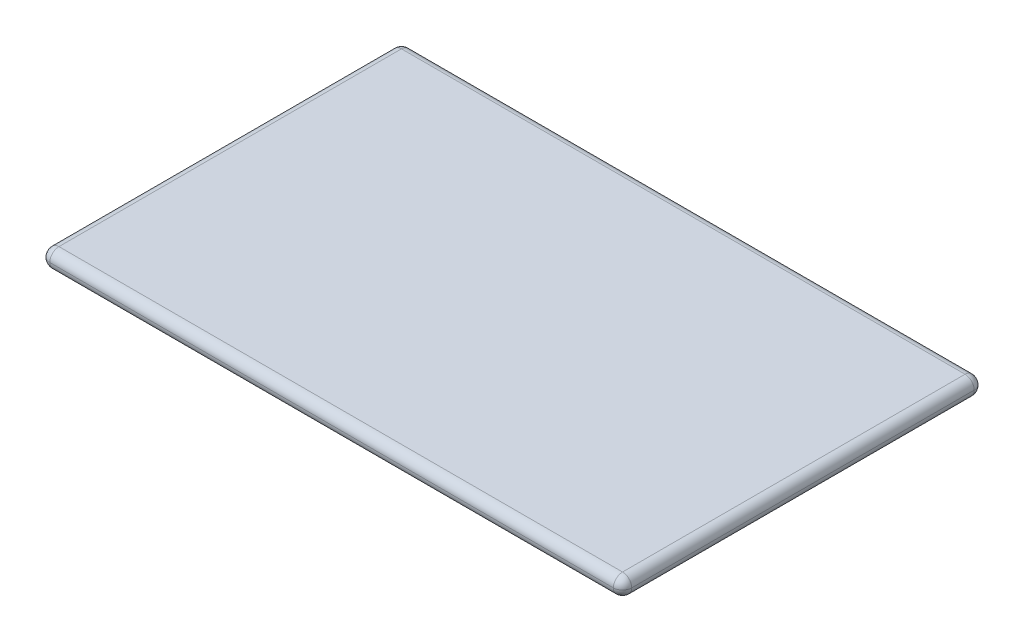
from build123d import *

# Parameters (mm, degrees)
BOSS_EXTRUDE1_DEPTH = 4.0005
FILLET3_R           = 0.2032


with BuildPart() as part:
    # Sketch1 → Boss-Extrude1 (new, symmetric)
    with BuildSketch(Plane.XY):
        Polygon((6.4516, 0.2032), (-6.4516, 0.2032), (-6.4516, -0.2032), (-6.0452, -0.2032), (6.0452, -0.2032), (6.4516, -0.2032), align=None)
    extrude(amount=BOSS_EXTRUDE1_DEPTH, both=True)

    # Fillet3
    fillet3_edges = [part.edges().sort_by_distance(p)[0] for p in [
        (-6.4516, 0, 4.0005),
        (0, -0.2032, 4.0005),
        (6.4516, 0, 4.0005),
        (0, -0.2032, -4.0005),
        (-6.4516, 0, -4.0005),
        (0, 0.2032, -4.0005),
        (6.4516, 0, -4.0005),
        (0, 0.2032, 4.0005),
        (6.4516, -0.2032, 0),
        (-6.4516, -0.2032, 0),
        (-6.4516, 0.2032, 0),
        (6.4516, 0.2032, 0),
    ]]
    fillet(fillet3_edges, radius=FILLET3_R - 0.0001)  # a hair under: the kernel refuses the full size


solid = part.part
